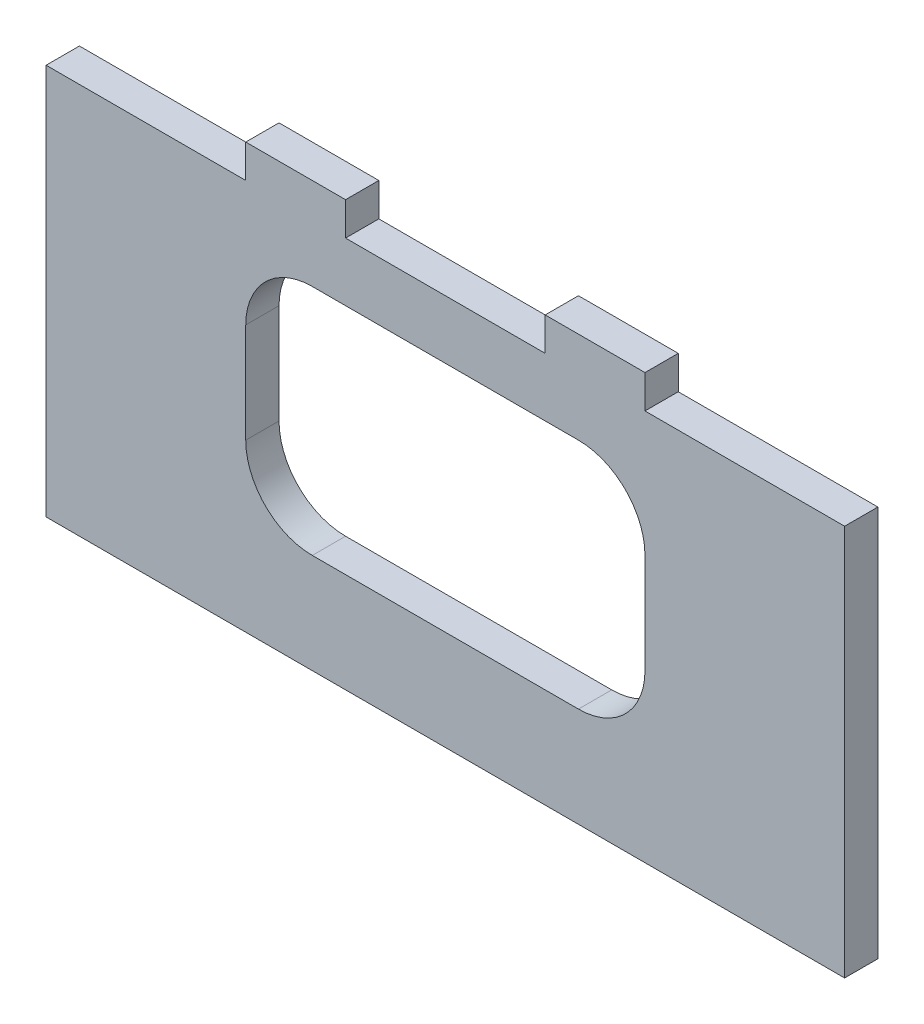
from build123d import *

# Parameters (mm, degrees)
SKIZZE1_W                       = 120
SKIZZE1_H                       = 58.8
AUFSATZ_LINEAR_AUSTRAGEN1_DEPTH = 5
SKIZZE2_W                       = 60
SKIZZE2_H                       = 35
SCHNITT_LINEAR_AUSTRAGEN1_DEPTH = 134.725240699
VERRUNDUNG1_R                   = 10
SKIZZE3_W                       = 15
SKIZZE3_H                       = 5
AUFSATZ_LINEAR_AUSTRAGEN2_DEPTH = 5


with BuildPart() as part:
    # Skizze1 → Aufsatz-Linear austragen1 (new body)
    with BuildSketch(Plane.XY):
        with Locations((60, 29.4)):
            Rectangle(SKIZZE1_W, SKIZZE1_H)
    extrude(amount=AUFSATZ_LINEAR_AUSTRAGEN1_DEPTH)

    # Skizze2 → Schnitt-Linear austragen1 (cut, through all)
    with BuildSketch(Plane.XY.offset(5)):
        with Locations((60, 32.5)):
            Rectangle(SKIZZE2_W, SKIZZE2_H)
    extrude(amount=-SCHNITT_LINEAR_AUSTRAGEN1_DEPTH, mode=Mode.SUBTRACT)

    # Verrundung1
    verrundung1_edges = [part.edges().sort_by_distance(p)[0] for p in [
        (30, 15, 2.5),
        (90, 15, 2.5),
        (90, 50, 2.5),
        (30, 50, 2.5),
    ]]
    fillet(verrundung1_edges, radius=VERRUNDUNG1_R)

    # Skizze3 → Aufsatz-Linear austragen2 (add)
    with BuildSketch(Plane(origin=(0, 58.8, 0), x_dir=(1, 0, 0), z_dir=(0, 1, 0))):
        with Locations((82.5, -2.5)):
            Rectangle(SKIZZE3_W, SKIZZE3_H)
        with Locations((37.5, -2.5)):
            Rectangle(SKIZZE3_W, SKIZZE3_H)
    extrude(amount=AUFSATZ_LINEAR_AUSTRAGEN2_DEPTH)


solid = part.part
